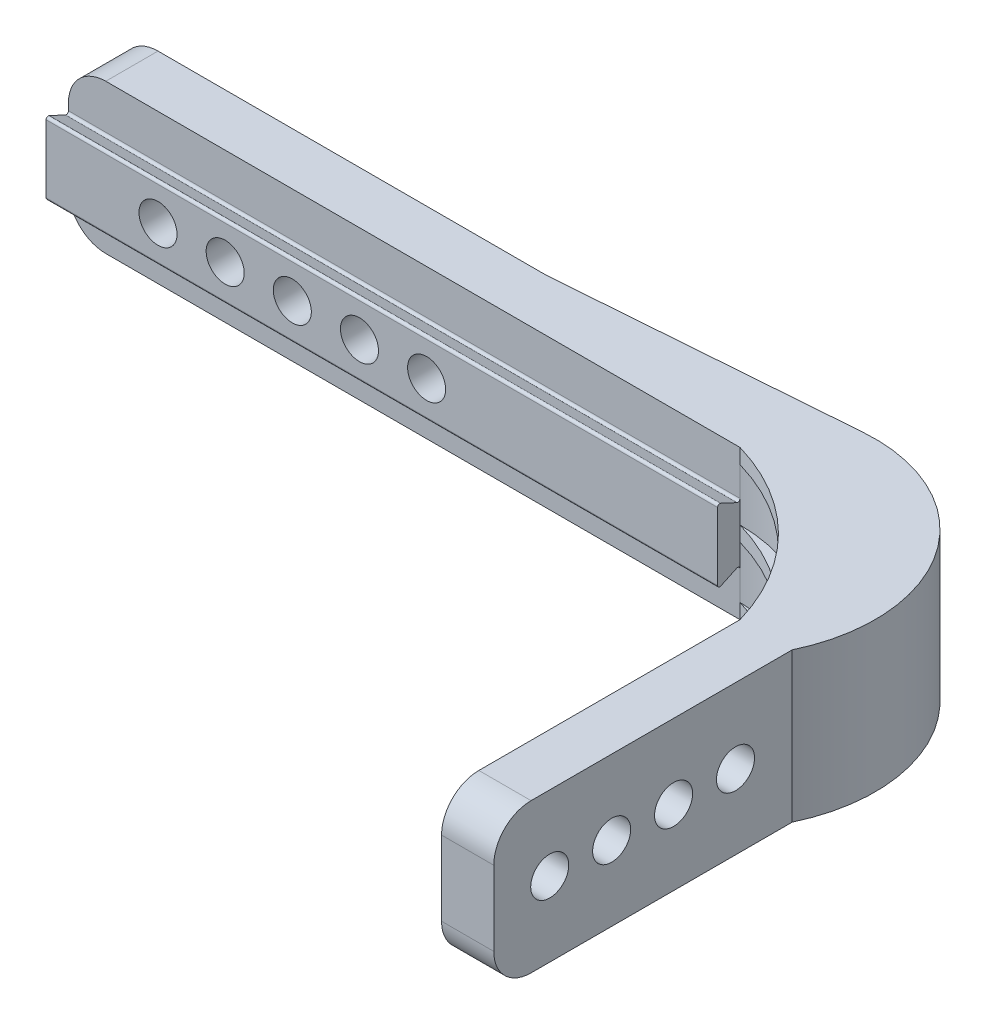
from build123d import *

# Parameters (mm, degrees)
BOSS_EXTRUDE1_DEPTH = 20
BOSS_EXTRUDE2_DEPTH = 90
SKETCH4_R           = 2.55
CUT_EXTRUDE1_DEPTH  = 137.301137193
LPATTERN1_COUNT     = 4
LPATTERN1_PITCH     = 8.3
SKETCH5_R           = 2.55
CUT_EXTRUDE2_DEPTH  = 14
LPATTERN2_COUNT     = 5
LPATTERN2_PITCH     = 9
FILLET2_R           = 5
BOSS_EXTRUDE4_DEPTH = 20
BOSS_EXTRUDE5_DEPTH = 2
LPATTERN3_COUNT     = 3
LPATTERN3_PITCH     = 9
FILLET3_R           = 0.3
FILLET4_R           = 20


with BuildPart() as part:
    # Sketch1 → Boss-Extrude1 (new body)
    with BuildSketch(Plane(origin=(0, 0, 0), x_dir=(1, 0, 0), z_dir=(0, 1, 0))):
        with BuildLine():
            Line((0, 0), (90, 0))
            ThreePointArc((90, 0), (109.091883092, -7.908116908), (117, -27))
            Line((117, -27), (117, -67))
            Line((117, -67), (110, -67))
            Line((110, -67), (110, -27))
            ThreePointArc((110, -27), (104.142135624, -12.857864376), (90, -7))
            Line((90, -7), (0, -7))
            Line((0, -7), (0, 0))
        make_face()
    extrude(amount=BOSS_EXTRUDE1_DEPTH)

    # Sketch2 → Boss-Extrude2 (add)
    with BuildSketch(Plane(origin=(0, 0, 0), x_dir=(0, 0, -1), z_dir=(1, 0, 0))):
        Polygon((-10, 15), (-10, 5), (-7, 6.398922974), (-7, 13.601077026), align=None)
    extrude(amount=BOSS_EXTRUDE2_DEPTH)

    # Sketch4 → Cut-Extrude1 (cut, through all)
    with BuildSketch(Plane(origin=(0, 0, 0), x_dir=(0, 0, -1), z_dir=(1, 0, 0))):
        with Locations(Location((-59.5, 10, 0), (0, 0, 180))):
            Circle(SKETCH4_R)
    cut_extrude1 = extrude(amount=CUT_EXTRUDE1_DEPTH, mode=Mode.SUBTRACT)

    # LPattern1: Cut-Extrude1 ×4
    with Locations(*[(0, 0, -i * LPATTERN1_PITCH) for i in range(1, LPATTERN1_COUNT)]):
        add(cut_extrude1, mode=Mode.SUBTRACT)

    # Sketch5 → Cut-Extrude2 (cut)
    with BuildSketch(Plane.XY):
        with Locations(Location((15, 10, 0), (0, 0, 90))):
            Circle(SKETCH5_R)
    cut_extrude2 = extrude(amount=CUT_EXTRUDE2_DEPTH, mode=Mode.SUBTRACT)

    # LPattern2: Cut-Extrude2 ×5
    with Locations(*[(i * LPATTERN2_PITCH, 0, 0) for i in range(1, LPATTERN2_COUNT)]):
        add(cut_extrude2, mode=Mode.SUBTRACT)

    # Fillet2
    fillet2_edges = [part.edges().sort_by_distance(p)[0] for p in [
        (0, 0, 3.5),
        (113.5, 20, 67),
        (0, 20, 3.5),
        (113.5, 0, 67),
    ]]
    fillet(fillet2_edges, radius=FILLET2_R)

    # Sketch6 → Boss-Extrude4 (add)
    with BuildSketch(Plane(origin=(0, 0, 0), x_dir=(1, 0, 0), z_dir=(0, 1, 0))):
        with BuildLine():
            Line((57.067989457, 0), (96.460545107, 3))
            ThreePointArc((96.460545107, 3), (115.383129249, -6.075834674), (117, -27))
            ThreePointArc((117, -27), (109.091883092, -7.908116908), (90, 0))
            Line((90, 0), (57.067989457, 0))
        make_face()
    extrude(amount=BOSS_EXTRUDE4_DEPTH)

    # Sketch8 → Boss-Extrude5 (add)
    with BuildSketch(Plane(origin=(0, 0, 0), x_dir=(1, 0, 0), z_dir=(0, 1, 0))):
        with BuildLine():
            ThreePointArc((90, -7), (102.578584062, -14.421415938), (110, -27))
            ThreePointArc((110, -27), (104.142135624, -12.857864376), (90, -7))
        make_face()
    boss_extrude5 = extrude(amount=BOSS_EXTRUDE5_DEPTH)

    # LPattern3: Boss-Extrude5 ×3
    with Locations(*[(0, i * LPATTERN3_PITCH, 0) for i in range(1, LPATTERN3_COUNT)]):
        add(boss_extrude5)

    # Fillet3
    fillet3_edges = [part.edges().sort_by_distance(p)[0] for p in [
        (45, 13.601077026, 7),
        (45, 15, 10),
        (45, 5, 10),
        (45, 6.398922974, 7),
    ]]
    fillet(fillet3_edges, radius=FILLET3_R)

    # Fillet4
    # the kernel refuses this fillet: 20 mm, written as the material it adds along each edge
    with BuildSketch(Plane(origin=(57.067989457, 0, 0), x_dir=(0.9971126456779296, 0, -0.07593663035162816), z_dir=(0, 1, 0))) as fillet4_piece_1:
        with BuildLine():
            CenterArc((FILLET4_R * 0.0380232084134, FILLET4_R), FILLET4_R, 265.644959248, 4.355040752)
            Line((-FILLET4_R * 0.0379134219382, FILLET4_R * 0.00288735432207), (0, 0))
            Line((0, 0), (FILLET4_R * 0.0380232084134, 0))
        make_face()
    extrude(amount=20)


solid = part.part
